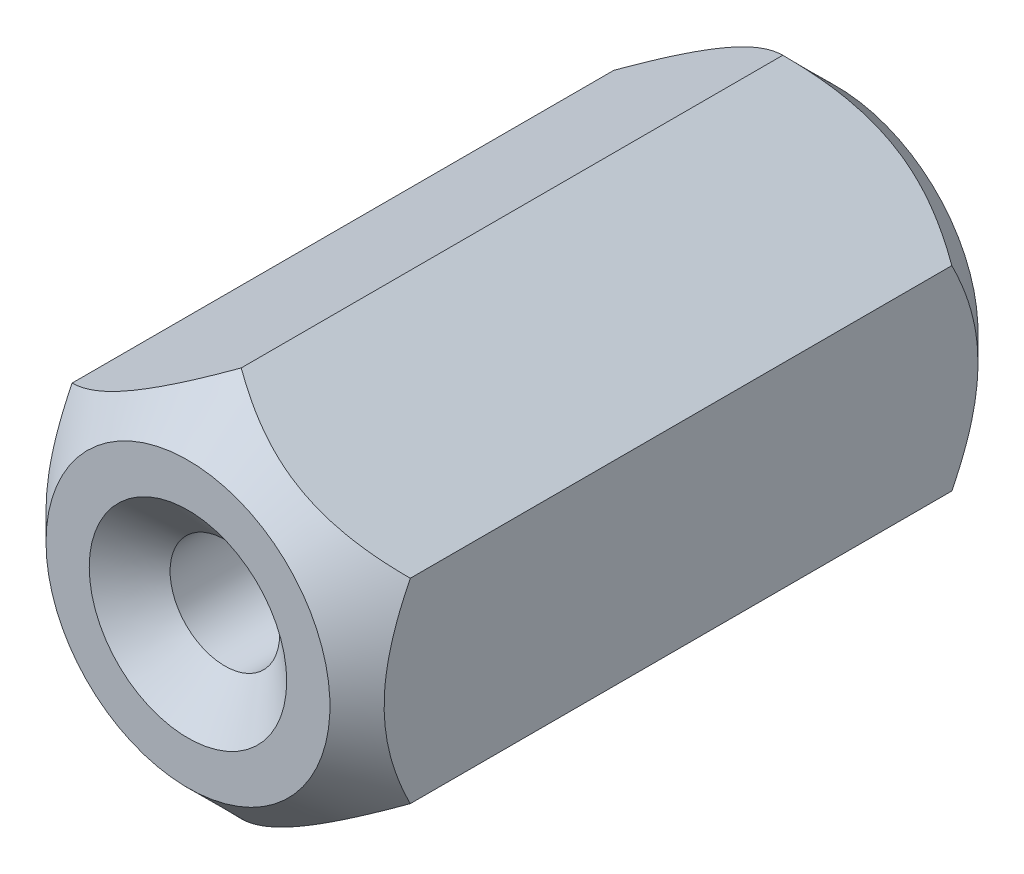
from build123d import *

# Parameters (mm, degrees)
BOSS_EXTRUDE1_DEPTH      = 6.085
BOSS_EXTRUDE1_DEPTH_BACK = 6.085


with BuildPart() as part:
    # Sketch1 → Boss-Extrude1 (new, two sides: drawn at the far end of the back side and taken through both)
    with BuildSketch(Plane.XY.offset(-BOSS_EXTRUDE1_DEPTH_BACK)):
        Polygon((3.175, -1.833087105), (3.175, 1.833087105), (0, 3.666174209), (-3.175, 1.833087105), (-3.175, -1.833087105), (0, -3.666174209), align=None)
    extrude(amount=BOSS_EXTRUDE1_DEPTH + BOSS_EXTRUDE1_DEPTH_BACK)

    # Sketch3 → Cut-Revolve2 (revolve, cut)
    with BuildSketch(Plane(origin=(0, 0, 0), x_dir=(0, 0, -1), z_dir=(1, 0, 0))):
        Polygon((-5.085, 3.666174209), (-6.085, 2.666174209), (-6.085, 3.666174209), align=None)
    cut_revolve2 = revolve(axis=Axis((0, 0, -0.635), (0, 0, 1)), mode=Mode.SUBTRACT)

    # Mirror1: Cut-Revolve2 across plane
    add(cut_revolve2.mirror(Plane.XY), mode=Mode.SUBTRACT)

    # Sketch4 → CSK for #1 Flat Head Machine Screw (100)1 (revolve, cut)
    with BuildSketch(Plane(origin=(0, 0, 6.085), x_dir=(0, -1, 0), z_dir=(1, 0, 0))):
        Polygon((0, 0), (0, 12.17), (1.6637, 12.17), (1.0287, 11.535), (1.0287, 0.692676746), (1.8542, 0), align=None)
    revolve(axis=Axis((0, 0, 12.435), (0, 0, -1)), mode=Mode.SUBTRACT)


solid = part.part
